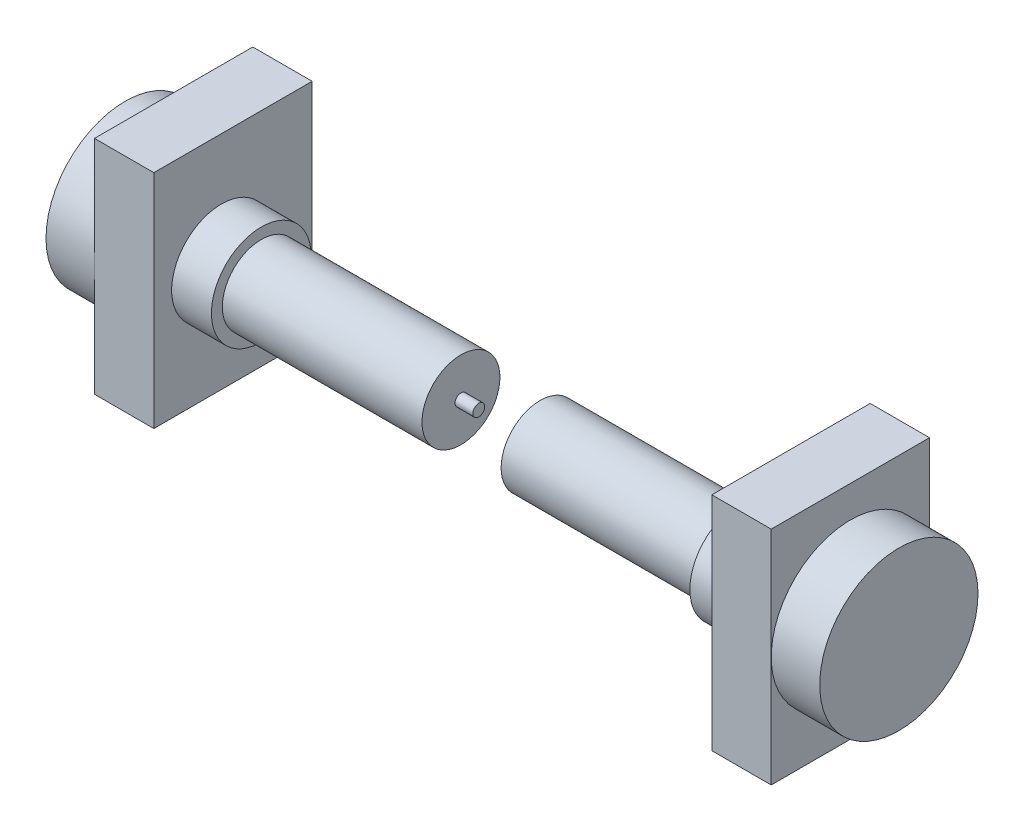
from build123d import *

# Parameters (mm, degrees)
ESQUISSE4_W          = 15
ESQUISSE4_H          = 56
BOSS_EXTRU_2_DEPTH   = 40
BOSS_EXTRU_2_2_DEPTH = 40
ESQUISSE5_R          = 20
BOSS_EXTRU_3_DEPTH   = 12.25
ESQUISSE6_R          = 20
BOSS_EXTRU_4_DEPTH   = 12.25
ESQUISSE7_R          = 12.6
BOSS_EXTRU_5_DEPTH   = 10.05
ESQUISSE9_R          = 12.6
BOSS_EXTRU_6_DEPTH   = 10.05
ESQUISSE11_R         = 9.85
BOSS_EXTRU_7_DEPTH   = 50.45
ESQUISSE12_R         = 9.85
BOSS_EXTRU_8_DEPTH   = 50.45
ESQUISSE13_R         = 1.5
BOSS_EXTRU_9_DEPTH   = 4.5
ESQUISSE14_R         = 1.5
BOSS_EXTRU_10_DEPTH  = 4.5


with BuildPart() as part:
    # Esquisse4 → Boss.-Extru.2 (new body)
    with BuildSketch(Plane.XY.offset(3)):
        with Locations((-78, 0)):
            Rectangle(ESQUISSE4_W, ESQUISSE4_H)
    extrude(amount=BOSS_EXTRU_2_DEPTH)


with BuildPart() as body_2:
    # Esquisse4 → Boss.-Extru.2 2 (new body)
    with BuildSketch(Plane.XY.offset(3)):
        with Locations((78, 0)):
            Rectangle(ESQUISSE4_W, ESQUISSE4_H)
    extrude(amount=BOSS_EXTRU_2_2_DEPTH)


with BuildPart() as body_3:
    # Esquisse5 → Boss.-Extru.3 (new body)
    with BuildSketch(Plane.ZY.offset(85.5)):
        with Locations((23, 0)):
            Circle(ESQUISSE5_R)
    extrude(amount=BOSS_EXTRU_3_DEPTH)


with BuildPart() as body_4:
    # Esquisse6 → Boss.-Extru.4 (new body)
    with BuildSketch(Plane(origin=(85.5, 0, 0), x_dir=(0, 0, -1), z_dir=(1, 0, 0))):
        with Locations((-23, 0)):
            Circle(ESQUISSE6_R)
    extrude(amount=BOSS_EXTRU_4_DEPTH)


with BuildPart() as body_5:
    # Esquisse7 → Boss.-Extru.5 (new body)
    with BuildSketch(Plane.ZY.offset(-70.5)):
        with Locations((25.9, 0)):
            Circle(ESQUISSE7_R)
    extrude(amount=BOSS_EXTRU_5_DEPTH)


with BuildPart() as body_6:
    # Esquisse9 → Boss.-Extru.6 (new body)
    with BuildSketch(Plane(origin=(-70.5, 0, 0), x_dir=(0, 0, -1), z_dir=(1, 0, 0))):
        with Locations((-25.9, 0)):
            Circle(ESQUISSE9_R)
    extrude(amount=BOSS_EXTRU_6_DEPTH)


with BuildPart() as body_7:
    # Esquisse11 → Boss.-Extru.7 (new body)
    with BuildSketch(Plane.ZY.offset(-60.45)):
        with Locations((25.9, 0)):
            Circle(ESQUISSE11_R)
    extrude(amount=BOSS_EXTRU_7_DEPTH)


with BuildPart() as body_8:
    # Esquisse12 → Boss.-Extru.8 (new body)
    with BuildSketch(Plane(origin=(-60.45, 0, 0), x_dir=(0, 0, -1), z_dir=(1, 0, 0))):
        with Locations((-25.9, 0)):
            Circle(ESQUISSE12_R)
    extrude(amount=BOSS_EXTRU_8_DEPTH)

    # Esquisse13 → Boss.-Extru.9 (add)
    with BuildSketch(Plane(origin=(-10, 0, 0), x_dir=(0, 0, -1), z_dir=(1, 0, 0))):
        with Locations((-25.9, 0)):
            Circle(ESQUISSE13_R)
    extrude(amount=BOSS_EXTRU_9_DEPTH)


with BuildPart() as body_9:
    # Esquisse14 → Boss.-Extru.10 (new body)
    with BuildSketch(Plane.ZY.offset(-10)):
        with Locations((25.9, 0)):
            Circle(ESQUISSE14_R)
    extrude(amount=BOSS_EXTRU_10_DEPTH)


solid = Compound([part.part, body_2.part, body_3.part, body_4.part, body_5.part, body_6.part, body_7.part, body_8.part, body_9.part])
